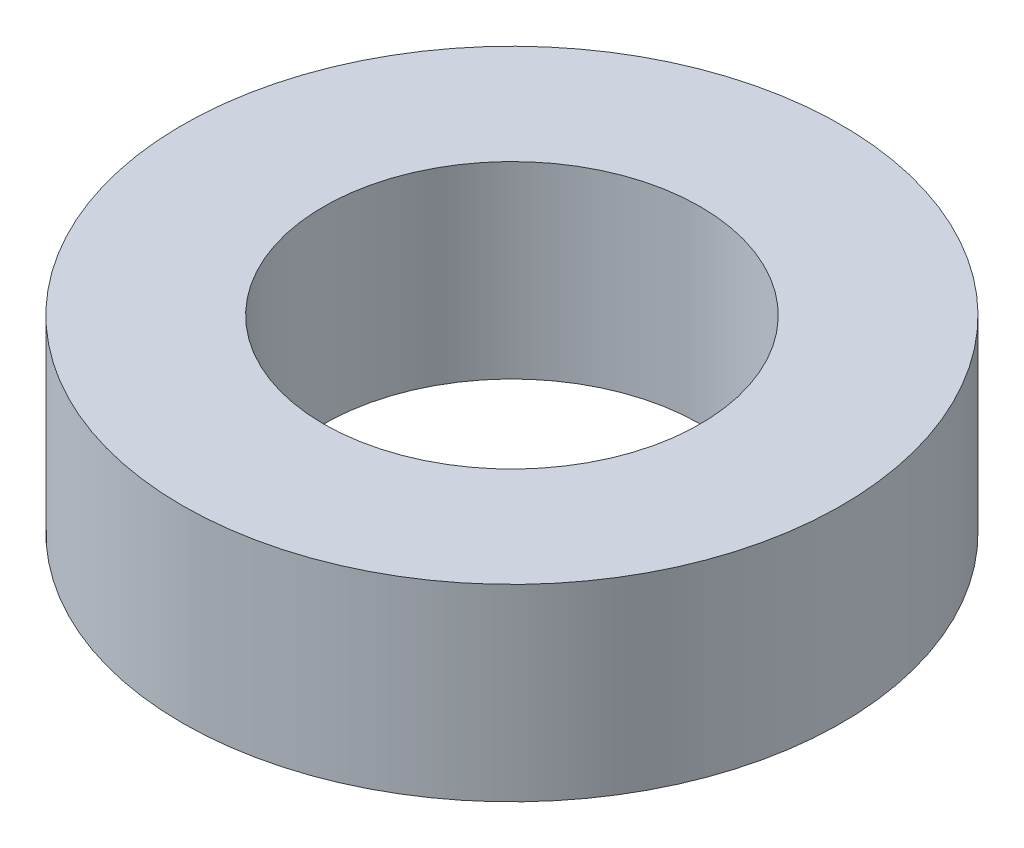
from build123d import *

# Parameters (mm, degrees)
SKETCH1_R           = 35
BOSS_EXTRUDE1_DEPTH = 20
SKETCH2_R           = 20
CUT_EXTRUDE1_DEPTH  = 54.38539126


with BuildPart() as part:
    # Sketch1 → Boss-Extrude1 (new body)
    with BuildSketch(Plane(origin=(0, 0, 0), x_dir=(1, 0, 0), z_dir=(0, 1, 0))):
        Circle(SKETCH1_R)
    extrude(amount=BOSS_EXTRUDE1_DEPTH)

    # Sketch2 → Cut-Extrude1 (cut, through all)
    with BuildSketch(Plane(origin=(0, 0, 0), x_dir=(1, 0, 0), z_dir=(0, 1, 0))):
        Circle(SKETCH2_R)
    extrude(amount=CUT_EXTRUDE1_DEPTH, mode=Mode.SUBTRACT)


solid = part.part
